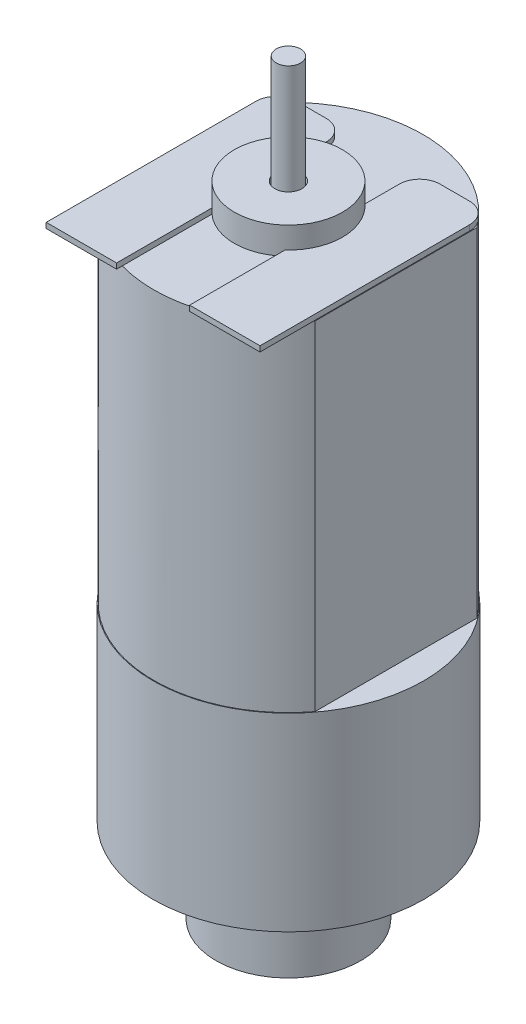
from build123d import *

# Parameters (mm, degrees)
SKETCH2_R           = 5
BOSS_EXTRUDE1_DEPTH = 7
BOSS_EXTRUDE2_DEPTH = 12.5
BOSS_EXTRUDE3_DEPTH = 0.2
SKETCH5_R           = 2
BOSS_EXTRUDE4_DEPTH = 1
SKETCH6_R           = 0.5
CUT_EXTRUDE1_DEPTH  = 2
SKETCH7_R           = 0.45
BOSS_EXTRUDE5_DEPTH = 6
SKETCH8_R           = 3.5
BOSS_EXTRUDE6_DEPTH = 0.02
SKETCH9_R           = 2.675
BOSS_EXTRUDE7_DEPTH = 3.1
SKETCH10_R          = 1.675
CUT_EXTRUDE2_DEPTH  = 2


with BuildPart() as part:
    # Sketch2 → Boss-Extrude1 (new body)
    with BuildSketch(Plane(origin=(0, 0, 0), x_dir=(1, 0, 0), z_dir=(0, 1, 0))):
        Circle(SKETCH2_R)
    extrude(amount=BOSS_EXTRUDE1_DEPTH)

    # Sketch3 → Boss-Extrude2 (add)
    with BuildSketch(Plane(origin=(0, 7, 0), x_dir=(1, 0, 0), z_dir=(0, 1, 0))):
        with BuildLine():
            Line((-3.975, 2.99165506), (-3.975, -2.99165506))
            ThreePointArc((-3.975, -2.99165506), (0, -4.975), (3.975, -2.99165506))
            Line((3.975, -2.99165506), (3.975, 2.99165506))
            ThreePointArc((3.975, 2.99165506), (0, 4.975), (-3.975, 2.99165506))
        make_face()
    extrude(amount=BOSS_EXTRUDE2_DEPTH)

    # Sketch4 → Boss-Extrude3 (add)
    with BuildSketch(Plane(origin=(0, 19.5, 0), x_dir=(1, 0, 0), z_dir=(0, 1, 0))):
        with BuildLine():
            Line((-3.2, 3.5), (-2.1, 3.5))
            ThreePointArc((-2.1, 3.5), (-1.569669914, 3.280330086), (-1.35, 2.75))
            Line((-1.35, 2.75), (-1.35, -5))
            Line((-1.35, -5), (-3.95, -5))
            Line((-3.95, -5), (-3.95, 2.75))
            ThreePointArc((-3.95, 2.75), (-3.730330086, 3.280330086), (-3.2, 3.5))
        make_face()
        with BuildLine():
            Line((3.95, -5), (1.35, -5))
            Line((1.35, -5), (1.35, 2.75))
            ThreePointArc((1.35, 2.75), (1.569669914, 3.280330086), (2.1, 3.5))
            Line((2.1, 3.5), (3.2, 3.5))
            ThreePointArc((3.2, 3.5), (3.730330086, 3.280330086), (3.95, 2.75))
            Line((3.95, 2.75), (3.95, -5))
        make_face()
    extrude(amount=BOSS_EXTRUDE3_DEPTH)

    # Sketch5 → Boss-Extrude4 (add)
    with BuildSketch(Plane(origin=(0, 19.5, 0), x_dir=(1, 0, 0), z_dir=(0, 1, 0))):
        Circle(SKETCH5_R)
    extrude(amount=BOSS_EXTRUDE4_DEPTH)

    # Sketch6 → Cut-Extrude1 (cut)
    with BuildSketch(Plane(origin=(0, 20.5, 0), x_dir=(1, 0, 0), z_dir=(0, 1, 0))):
        Circle(SKETCH6_R)
    extrude(amount=-CUT_EXTRUDE1_DEPTH, mode=Mode.SUBTRACT)

    # Sketch7 → Boss-Extrude5 (add)
    with BuildSketch(Plane(origin=(0, 18.5, 0), x_dir=(1, 0, 0), z_dir=(0, 1, 0))):
        Circle(SKETCH7_R)
    extrude(amount=BOSS_EXTRUDE5_DEPTH)

    # Sketch8 → Boss-Extrude6 (add)
    with BuildSketch(Plane.XZ):
        Circle(SKETCH8_R)
    extrude(amount=BOSS_EXTRUDE6_DEPTH)

    # Sketch9 → Boss-Extrude7 (add)
    with BuildSketch(Plane.XZ.offset(0.02)):
        Circle(SKETCH9_R)
    extrude(amount=BOSS_EXTRUDE7_DEPTH)

    # Sketch10 → Cut-Extrude2 (cut)
    with BuildSketch(Plane.XZ.offset(3.12)):
        Circle(SKETCH10_R)
    extrude(amount=-CUT_EXTRUDE2_DEPTH, mode=Mode.SUBTRACT)


solid = part.part
